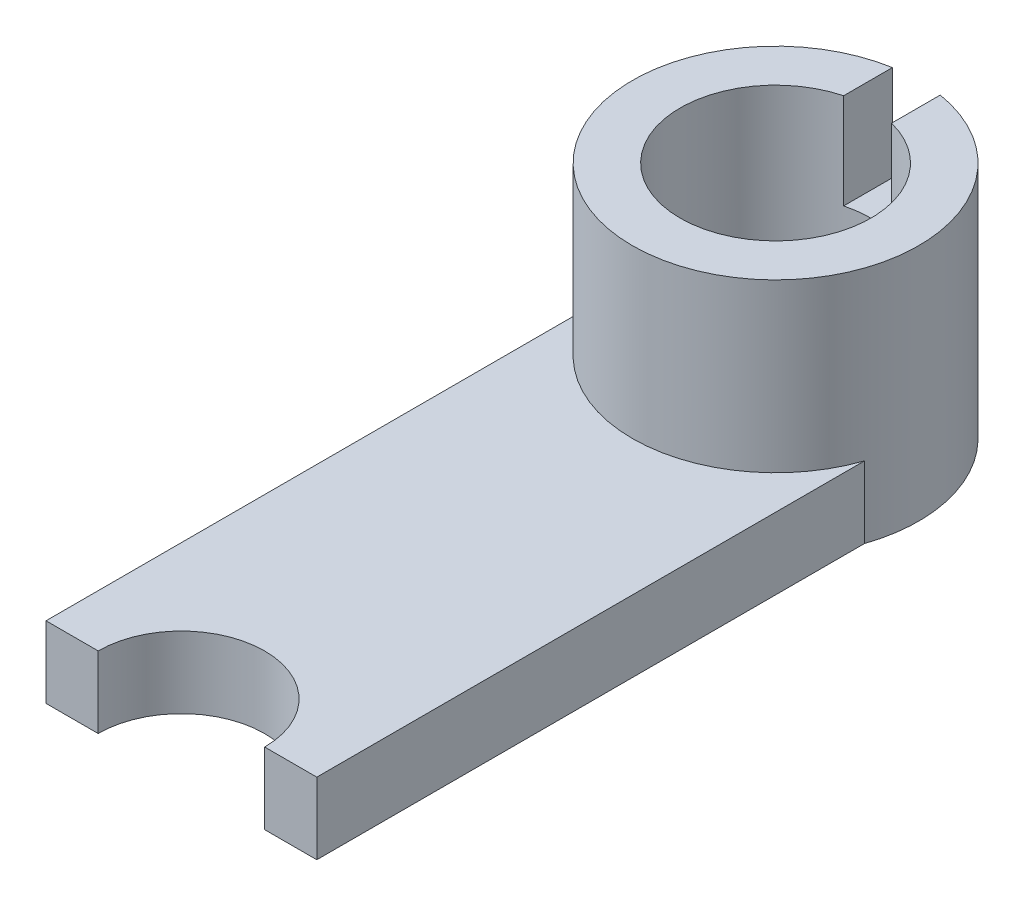
from build123d import *

# Parameters (mm, degrees)
SKETCH2_R               = 60000
SKETCH2_R_2             = 40000
BOSS_EXTRUDE1_DEPTH     = 100000
CUT_EXTRUDE1_DEPTH      = 14630
CUT_EXTRUDE1_DEPTH_BACK = 40000
SKETCH3_W               = 20000
SKETCH3_H               = 53751.270372234
SKETCH6_W               = 113487.639637956
SKETCH6_H               = 229519.025629528
BOSS_EXTRUDE3_DEPTH     = 30000
CUT_EXTRUDE2_DEPTH      = 28505
CUT_EXTRUDE2_DEPTH_BACK = 58994
SKETCH7_R               = 34880.887530656
CUT_EXTRUDE4_DEPTH      = 51190
CUT_EXTRUDE4_DEPTH_BACK = 76239
SKETCH8_R               = 40000


with BuildPart() as part:
    # Sketch2 → Boss-Extrude1 (new body)
    with BuildSketch(Plane(origin=(0, 0, 0), x_dir=(1, 0, 0), z_dir=(0, 1, 0))):
        Circle(SKETCH2_R)
        Circle(SKETCH2_R_2, mode=Mode.SUBTRACT)
    extrude(amount=BOSS_EXTRUDE1_DEPTH)

    # Sketch3 → Cut-Extrude1 (cut, two sides: drawn at the far end of the back side and taken through both)
    with BuildSketch(Plane(origin=(0, 100000, 0), x_dir=(1, 0, 0), z_dir=(0, 1, 0)).offset(-CUT_EXTRUDE1_DEPTH_BACK)):
        with Locations((-166.372945862, 35059.052743673)):
            Rectangle(SKETCH3_W, SKETCH3_H)
    extrude(amount=CUT_EXTRUDE1_DEPTH + CUT_EXTRUDE1_DEPTH_BACK, mode=Mode.SUBTRACT)

    # Sketch6 → Boss-Extrude3 (add)
    with BuildSketch(Plane.XZ):
        with Locations((0, 134256.664205451)):
            Rectangle(SKETCH6_W, SKETCH6_H)
    extrude(amount=-BOSS_EXTRUDE3_DEPTH)

    # Sketch7 → Cut-Extrude2 (cut, two sides: drawn at the far end of the back side and taken through both)
    with BuildSketch(Plane(origin=(0, 30000, 0), x_dir=(1, 0, 0), z_dir=(0, 1, 0)).offset(-CUT_EXTRUDE2_DEPTH_BACK)):
        with Locations((0, -249016.177020215)):
            Circle(SKETCH7_R)
    extrude(amount=CUT_EXTRUDE2_DEPTH + CUT_EXTRUDE2_DEPTH_BACK, mode=Mode.SUBTRACT)

    # Sketch8 → Cut-Extrude4 (cut, two sides: drawn at the far end of the back side and taken through both)
    with BuildSketch(Plane(origin=(0, 30000, 0), x_dir=(1, 0, 0), z_dir=(0, 1, 0)).offset(-CUT_EXTRUDE4_DEPTH_BACK)):
        Circle(SKETCH8_R)
    extrude(amount=CUT_EXTRUDE4_DEPTH + CUT_EXTRUDE4_DEPTH_BACK, mode=Mode.SUBTRACT)


solid = part.part
